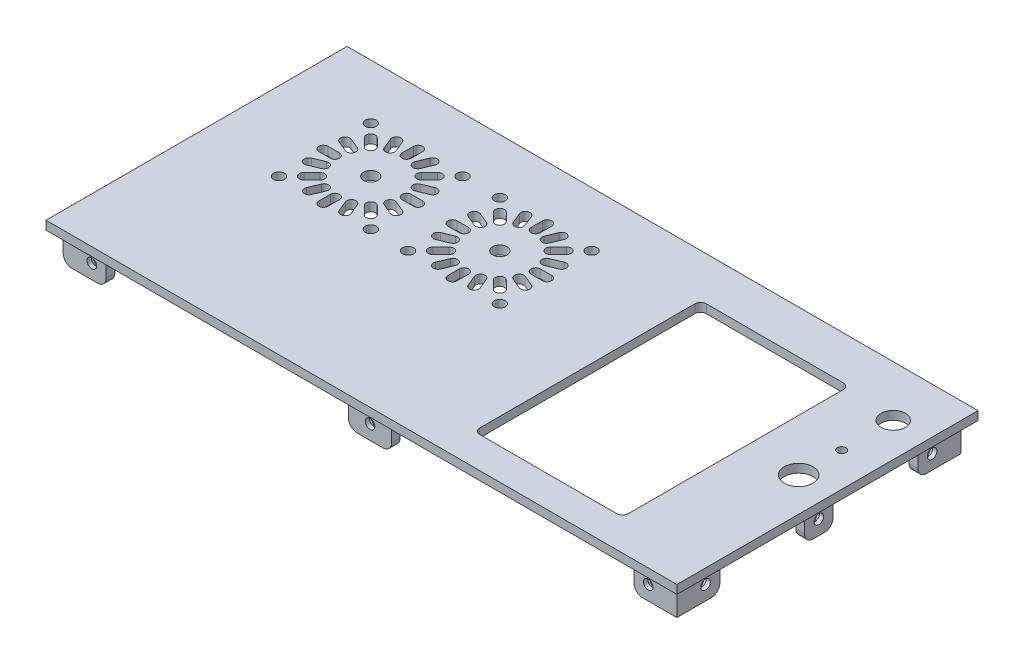
from build123d import *

# Parameters (mm, degrees)
IZIM1_W                     = 220
IZIM1_H                     = 105
IZIM1_R                     = 4.25
IZIM1_R_2                   = 5
IZIM1_R_3                   = 1.5
IZIM1_R_4                   = 1.9
IZIM1_R_5                   = 2.5
Y_KSEKLIK_EKSTR_ZYON1_DEPTH = 3
IZIM2_W                     = 15
IZIM2_H                     = 3
IZIM2_W_2                   = 3
IZIM2_H_2                   = 10
Y_KSEKLIK_EKSTR_ZYON3_DEPTH = 10
IZIM3_R                     = 1.675
KES_EKSTR_ZYON1_DEPTH       = 120
IZIM4_R                     = 1.675
KES_EKSTR_ZYON2_DEPTH       = 215
IZIM5_R                     = 1.675
IZIM5_W                     = 7.5
IZIM5_H                     = 10
KES_EKSTR_ZYON3_DEPTH       = 3
IZIM6_W                     = 12
IZIM6_H                     = 10
KES_EKSTR_ZYON4_DEPTH       = 3
RADYUS1_R                   = 3
KES_EKSTR_ZYON5_DEPTH       = 1.5
KES_EKSTR_ZYON6_DEPTH       = 1.5
KES_EKSTR_ZYON7_DEPTH       = 1.5
KES_EKSTR_ZYON8_DEPTH       = 1.5
PAH1_SIZE                   = 1


with BuildPart() as part:
    # Çizim1 → Yükseklik-Ekstrüzyon1 (new body)
    with BuildSketch(Plane(origin=(0, 0, 0), x_dir=(1, 0, 0), z_dir=(0, 1, 0))):
        Rectangle(IZIM1_W, IZIM1_H)
        with Locations(Location((98.15, 34.8, 0), (0, 0, 270))):
            Circle(IZIM1_R, mode=Mode.SUBTRACT)
        with Locations(Location((98.15, 1.8, 0), (0, 0, 270))):
            Circle(IZIM1_R_2, mode=Mode.SUBTRACT)
        with Locations(Location((98.15, 16.8, 0), (0, 0, 270))):
            Circle(IZIM1_R_3, mode=Mode.SUBTRACT)
        with Locations(Location((-82.65, 33.4, 0), (0, 0, 270))):
            Circle(IZIM1_R_4, mode=Mode.SUBTRACT)
        with Locations(Location((-50.65, 33.4, 0), (0, 0, 270))):
            Circle(IZIM1_R_4, mode=Mode.SUBTRACT)
        with Locations(Location((-37.65, 33.4, 0), (0, 0, 270))):
            Circle(IZIM1_R_4, mode=Mode.SUBTRACT)
        with Locations(Location((-5.65, 33.4, 0), (0, 0, 270))):
            Circle(IZIM1_R_4, mode=Mode.SUBTRACT)
        with Locations(Location((-5.65, 1.4, 0), (0, 0, 270))):
            Circle(IZIM1_R_4, mode=Mode.SUBTRACT)
        with Locations(Location((-37.65, 1.4, 0), (0, 0, 270))):
            Circle(IZIM1_R_4, mode=Mode.SUBTRACT)
        with Locations(Location((-50.65, 1.4, 0), (0, 0, 270))):
            Circle(IZIM1_R_4, mode=Mode.SUBTRACT)
        with Locations(Location((-82.65, 1.4, 0), (0, 0, 270))):
            Circle(IZIM1_R_4, mode=Mode.SUBTRACT)
        with Locations(Location((-66.65, 17.4, 0), (0, 0, 270))):
            Circle(IZIM1_R_5, mode=Mode.SUBTRACT)
        with Locations(Location((-21.65, 17.4, 0), (0, 0, 270))):
            Circle(IZIM1_R_5, mode=Mode.SUBTRACT)
        with BuildLine():
            Line((78.15, 37.4), (30.35, 37.4))
            ThreePointArc((30.35, 37.4), (28.935786438, 36.814213562), (28.35, 35.4))
            Line((28.35, 35.4), (28.35, -39.6))
            ThreePointArc((28.35, -39.6), (28.935786438, -41.014213562), (30.35, -41.6))
            Line((30.35, -41.6), (78.15, -41.6))
            ThreePointArc((78.15, -41.6), (79.564213562, -41.014213562), (80.15, -39.6))
            Line((80.15, -39.6), (80.15, 35.4))
            ThreePointArc((80.15, 35.4), (79.564213562, 36.814213562), (78.15, 37.4))
        make_face(mode=Mode.SUBTRACT)
        with BuildLine():
            Line((-68.25, 29.9), (-68.25, 33.9))
            ThreePointArc((-68.25, 33.9), (-66.65, 35.5), (-65.05, 33.9))
            Line((-65.05, 33.9), (-65.05, 29.9))
            ThreePointArc((-65.05, 29.9), (-66.65, 28.3), (-68.25, 29.9))
        make_face(mode=Mode.SUBTRACT)
        with BuildLine():
            Line((-72.911750157, 28.336200665), (-74.442483886, 32.031718795))
            ThreePointArc((-74.442483886, 32.031718795), (-73.576570126, 34.122219538), (-71.486069382, 33.256305778))
            Line((-71.486069382, 33.256305778), (-69.955335653, 29.560787648))
            ThreePointArc((-69.955335653, 29.560787648), (-70.821249413, 27.470286904), (-72.911750157, 28.336200665))
        make_face(mode=Mode.SUBTRACT)
        with BuildLine():
            Line((-79.15, 19), (-83.15, 19))
            ThreePointArc((-83.15, 19), (-84.75, 17.4), (-83.15, 15.8))
            Line((-83.15, 15.8), (-79.15, 15.8))
            ThreePointArc((-79.15, 15.8), (-77.55, 17.4), (-79.15, 19))
        make_face(mode=Mode.SUBTRACT)
        with BuildLine():
            Line((-77.586200665, 23.661750157), (-81.281718795, 25.192483886))
            ThreePointArc((-81.281718795, 25.192483886), (-83.372219538, 24.326570126), (-82.506305778, 22.236069382))
            Line((-82.506305778, 22.236069382), (-78.810787648, 20.705335653))
            ThreePointArc((-78.810787648, 20.705335653), (-76.720286904, 21.571249413), (-77.586200665, 23.661750157))
        make_face(mode=Mode.SUBTRACT)
        with BuildLine():
            Line((-74.357463915, 27.370205615), (-77.18589104, 30.198632739))
            ThreePointArc((-77.18589104, 30.198632739), (-79.448632739, 30.198632739), (-79.448632739, 27.93589104))
            Line((-79.448632739, 27.93589104), (-76.620205615, 25.107463915))
            ThreePointArc((-76.620205615, 25.107463915), (-74.357463915, 25.107463915), (-74.357463915, 27.370205615))
        make_face(mode=Mode.SUBTRACT)
        with BuildLine():
            Line((-77.586200665, 11.138249843), (-81.281718795, 9.607516114))
            ThreePointArc((-81.281718795, 9.607516114), (-83.372219538, 10.473429874), (-82.506305778, 12.563930618))
            Line((-82.506305778, 12.563930618), (-78.810787648, 14.094664347))
            ThreePointArc((-78.810787648, 14.094664347), (-76.720286904, 13.228750587), (-77.586200665, 11.138249843))
        make_face(mode=Mode.SUBTRACT)
        with BuildLine():
            Line((-74.357463915, 7.429794385), (-77.18589104, 4.601367261))
            ThreePointArc((-77.18589104, 4.601367261), (-79.448632739, 4.601367261), (-79.448632739, 6.86410896))
            Line((-79.448632739, 6.86410896), (-76.620205615, 9.692536085))
            ThreePointArc((-76.620205615, 9.692536085), (-74.357463915, 9.692536085), (-74.357463915, 7.429794385))
        make_face(mode=Mode.SUBTRACT)
        with BuildLine():
            Line((-72.911750157, 6.463799335), (-74.442483886, 2.768281205))
            ThreePointArc((-74.442483886, 2.768281205), (-73.576570126, 0.677780462), (-71.486069382, 1.543694222))
            Line((-71.486069382, 1.543694222), (-69.955335653, 5.239212352))
            ThreePointArc((-69.955335653, 5.239212352), (-70.821249413, 7.329713096), (-72.911750157, 6.463799335))
        make_face(mode=Mode.SUBTRACT)
        with BuildLine():
            Line((-68.25, 4.9), (-68.25, 0.9))
            ThreePointArc((-68.25, 0.9), (-66.65, -0.7), (-65.05, 0.9))
            Line((-65.05, 0.9), (-65.05, 4.9))
            ThreePointArc((-65.05, 4.9), (-66.65, 6.5), (-68.25, 4.9))
        make_face(mode=Mode.SUBTRACT)
        with BuildLine():
            Line((-54.15, 19), (-50.15, 19))
            ThreePointArc((-50.15, 19), (-48.55, 17.4), (-50.15, 15.8))
            Line((-50.15, 15.8), (-54.15, 15.8))
            ThreePointArc((-54.15, 15.8), (-55.75, 17.4), (-54.15, 19))
        make_face(mode=Mode.SUBTRACT)
        with BuildLine():
            Line((-55.713799335, 23.661750157), (-52.018281205, 25.192483886))
            ThreePointArc((-52.018281205, 25.192483886), (-49.927780462, 24.326570126), (-50.793694222, 22.236069382))
            Line((-50.793694222, 22.236069382), (-54.489212352, 20.705335653))
            ThreePointArc((-54.489212352, 20.705335653), (-56.579713096, 21.571249413), (-55.713799335, 23.661750157))
        make_face(mode=Mode.SUBTRACT)
        with BuildLine():
            Line((-58.942536085, 27.370205615), (-56.11410896, 30.198632739))
            ThreePointArc((-56.11410896, 30.198632739), (-53.851367261, 30.198632739), (-53.851367261, 27.93589104))
            Line((-53.851367261, 27.93589104), (-56.679794385, 25.107463915))
            ThreePointArc((-56.679794385, 25.107463915), (-58.942536085, 25.107463915), (-58.942536085, 27.370205615))
        make_face(mode=Mode.SUBTRACT)
        with BuildLine():
            Line((-60.388249843, 28.336200665), (-58.857516114, 32.031718795))
            ThreePointArc((-58.857516114, 32.031718795), (-59.723429874, 34.122219538), (-61.813930618, 33.256305778))
            Line((-61.813930618, 33.256305778), (-63.344664347, 29.560787648))
            ThreePointArc((-63.344664347, 29.560787648), (-62.478750587, 27.470286904), (-60.388249843, 28.336200665))
        make_face(mode=Mode.SUBTRACT)
        with BuildLine():
            Line((-55.713799335, 11.138249843), (-52.018281205, 9.607516114))
            ThreePointArc((-52.018281205, 9.607516114), (-49.927780462, 10.473429874), (-50.793694222, 12.563930618))
            Line((-50.793694222, 12.563930618), (-54.489212352, 14.094664347))
            ThreePointArc((-54.489212352, 14.094664347), (-56.579713096, 13.228750587), (-55.713799335, 11.138249843))
        make_face(mode=Mode.SUBTRACT)
        with BuildLine():
            Line((-58.942536085, 7.429794385), (-56.11410896, 4.601367261))
            ThreePointArc((-56.11410896, 4.601367261), (-53.851367261, 4.601367261), (-53.851367261, 6.86410896))
            Line((-53.851367261, 6.86410896), (-56.679794385, 9.692536085))
            ThreePointArc((-56.679794385, 9.692536085), (-58.942536085, 9.692536085), (-58.942536085, 7.429794385))
        make_face(mode=Mode.SUBTRACT)
        with BuildLine():
            Line((-60.388249843, 6.463799335), (-58.857516114, 2.768281205))
            ThreePointArc((-58.857516114, 2.768281205), (-59.723429874, 0.677780462), (-61.813930618, 1.543694222))
            Line((-61.813930618, 1.543694222), (-63.344664347, 5.239212352))
            ThreePointArc((-63.344664347, 5.239212352), (-62.478750587, 7.329713096), (-60.388249843, 6.463799335))
        make_face(mode=Mode.SUBTRACT)
        with BuildLine():
            Line((-15.388249843, 28.336200665), (-13.857516114, 32.031718795))
            ThreePointArc((-13.857516114, 32.031718795), (-14.723429874, 34.122219538), (-16.813930618, 33.256305778))
            Line((-16.813930618, 33.256305778), (-18.344664347, 29.560787648))
            ThreePointArc((-18.344664347, 29.560787648), (-17.478750587, 27.470286904), (-15.388249843, 28.336200665))
        make_face(mode=Mode.SUBTRACT)
        with BuildLine():
            Line((-13.942536085, 27.370205615), (-11.11410896, 30.198632739))
            ThreePointArc((-11.11410896, 30.198632739), (-8.851367261, 30.198632739), (-8.851367261, 27.93589104))
            Line((-8.851367261, 27.93589104), (-11.679794385, 25.107463915))
            ThreePointArc((-11.679794385, 25.107463915), (-13.942536085, 25.107463915), (-13.942536085, 27.370205615))
        make_face(mode=Mode.SUBTRACT)
        with BuildLine():
            Line((-10.713799335, 23.661750157), (-7.018281205, 25.192483886))
            ThreePointArc((-7.018281205, 25.192483886), (-4.927780462, 24.326570126), (-5.793694222, 22.236069382))
            Line((-5.793694222, 22.236069382), (-9.489212352, 20.705335653))
            ThreePointArc((-9.489212352, 20.705335653), (-11.579713096, 21.571249413), (-10.713799335, 23.661750157))
        make_face(mode=Mode.SUBTRACT)
        with BuildLine():
            Line((-9.15, 19), (-5.15, 19))
            ThreePointArc((-5.15, 19), (-3.55, 17.4), (-5.15, 15.8))
            Line((-5.15, 15.8), (-9.15, 15.8))
            ThreePointArc((-9.15, 15.8), (-10.75, 17.4), (-9.15, 19))
        make_face(mode=Mode.SUBTRACT)
        with BuildLine():
            Line((-10.713799335, 11.138249843), (-7.018281205, 9.607516114))
            ThreePointArc((-7.018281205, 9.607516114), (-4.927780462, 10.473429874), (-5.793694222, 12.563930618))
            Line((-5.793694222, 12.563930618), (-9.489212352, 14.094664347))
            ThreePointArc((-9.489212352, 14.094664347), (-11.579713096, 13.228750587), (-10.713799335, 11.138249843))
        make_face(mode=Mode.SUBTRACT)
        with BuildLine():
            Line((-13.942536085, 7.429794385), (-11.11410896, 4.601367261))
            ThreePointArc((-11.11410896, 4.601367261), (-8.851367261, 4.601367261), (-8.851367261, 6.86410896))
            Line((-8.851367261, 6.86410896), (-11.679794385, 9.692536085))
            ThreePointArc((-11.679794385, 9.692536085), (-13.942536085, 9.692536085), (-13.942536085, 7.429794385))
        make_face(mode=Mode.SUBTRACT)
        with BuildLine():
            Line((-15.388249843, 6.463799335), (-13.857516114, 2.768281205))
            ThreePointArc((-13.857516114, 2.768281205), (-14.723429874, 0.677780462), (-16.813930618, 1.543694222))
            Line((-16.813930618, 1.543694222), (-18.344664347, 5.239212352))
            ThreePointArc((-18.344664347, 5.239212352), (-17.478750587, 7.329713096), (-15.388249843, 6.463799335))
        make_face(mode=Mode.SUBTRACT)
        with BuildLine():
            Line((-20.05, 4.9), (-20.05, 0.9))
            ThreePointArc((-20.05, 0.9), (-21.65, -0.7), (-23.25, 0.9))
            Line((-23.25, 0.9), (-23.25, 4.9))
            ThreePointArc((-23.25, 4.9), (-21.65, 6.5), (-20.05, 4.9))
        make_face(mode=Mode.SUBTRACT)
        with BuildLine():
            Line((-20.05, 29.9), (-20.05, 33.9))
            ThreePointArc((-20.05, 33.9), (-21.65, 35.5), (-23.25, 33.9))
            Line((-23.25, 33.9), (-23.25, 29.9))
            ThreePointArc((-23.25, 29.9), (-21.65, 28.3), (-20.05, 29.9))
        make_face(mode=Mode.SUBTRACT)
        with BuildLine():
            Line((-27.911750157, 6.463799335), (-29.442483886, 2.768281205))
            ThreePointArc((-29.442483886, 2.768281205), (-28.576570126, 0.677780462), (-26.486069382, 1.543694222))
            Line((-26.486069382, 1.543694222), (-24.955335653, 5.239212352))
            ThreePointArc((-24.955335653, 5.239212352), (-25.821249413, 7.329713096), (-27.911750157, 6.463799335))
        make_face(mode=Mode.SUBTRACT)
        with BuildLine():
            Line((-29.357463915, 7.429794385), (-32.18589104, 4.601367261))
            ThreePointArc((-32.18589104, 4.601367261), (-34.448632739, 4.601367261), (-34.448632739, 6.86410896))
            Line((-34.448632739, 6.86410896), (-31.620205615, 9.692536085))
            ThreePointArc((-31.620205615, 9.692536085), (-29.357463915, 9.692536085), (-29.357463915, 7.429794385))
        make_face(mode=Mode.SUBTRACT)
        with BuildLine():
            Line((-32.586200665, 11.138249843), (-36.281718795, 9.607516114))
            ThreePointArc((-36.281718795, 9.607516114), (-38.372219538, 10.473429874), (-37.506305778, 12.563930618))
            Line((-37.506305778, 12.563930618), (-33.810787648, 14.094664347))
            ThreePointArc((-33.810787648, 14.094664347), (-31.720286904, 13.228750587), (-32.586200665, 11.138249843))
        make_face(mode=Mode.SUBTRACT)
        with BuildLine():
            Line((-34.15, 19), (-38.15, 19))
            ThreePointArc((-38.15, 19), (-39.75, 17.4), (-38.15, 15.8))
            Line((-38.15, 15.8), (-34.15, 15.8))
            ThreePointArc((-34.15, 15.8), (-32.55, 17.4), (-34.15, 19))
        make_face(mode=Mode.SUBTRACT)
        with BuildLine():
            Line((-32.586200665, 23.661750157), (-36.281718795, 25.192483886))
            ThreePointArc((-36.281718795, 25.192483886), (-38.372219538, 24.326570126), (-37.506305778, 22.236069382))
            Line((-37.506305778, 22.236069382), (-33.810787648, 20.705335653))
            ThreePointArc((-33.810787648, 20.705335653), (-31.720286904, 21.571249413), (-32.586200665, 23.661750157))
        make_face(mode=Mode.SUBTRACT)
        with BuildLine():
            Line((-29.357463915, 27.370205615), (-32.18589104, 30.198632739))
            ThreePointArc((-32.18589104, 30.198632739), (-34.448632739, 30.198632739), (-34.448632739, 27.93589104))
            Line((-34.448632739, 27.93589104), (-31.620205615, 25.107463915))
            ThreePointArc((-31.620205615, 25.107463915), (-29.357463915, 25.107463915), (-29.357463915, 27.370205615))
        make_face(mode=Mode.SUBTRACT)
        with BuildLine():
            Line((-27.911750157, 28.336200665), (-29.442483886, 32.031718795))
            ThreePointArc((-29.442483886, 32.031718795), (-28.576570126, 34.122219538), (-26.486069382, 33.256305778))
            Line((-26.486069382, 33.256305778), (-24.955335653, 29.560787648))
            ThreePointArc((-24.955335653, 29.560787648), (-25.821249413, 27.470286904), (-27.911750157, 28.336200665))
        make_face(mode=Mode.SUBTRACT)
    extrude(amount=Y_KSEKLIK_EKSTR_ZYON1_DEPTH)

    # Çizim2 → Yükseklik-Ekstrüzyon3 (add)
    with BuildSketch(Plane.XZ):
        Polygon((92, 49.5), (107, 49.5), (107, 34.5), (104, 34.5), (104, 46.5), (92, 46.5), align=None)
        Polygon((107, -34.5), (104, -34.5), (104, -46.5), (92, -46.5), (92, -49.5), (107, -49.5), align=None)
        Polygon((-92, -49.5), (-107, -49.5), (-107, -34.5), (-104, -34.5), (-104, -46.5), (-92, -46.5), align=None)
        Polygon((-92, 46.5), (-92, 49.5), (-107, 49.5), (-107, 34.5), (-104, 34.5), (-104, 46.5), align=None)
        with Locations((0, 48)):
            Rectangle(IZIM2_W, IZIM2_H)
        with Locations((0, -48)):
            Rectangle(IZIM2_W, IZIM2_H)
        with Locations((-105.5, 0)):
            Rectangle(IZIM2_W_2, IZIM2_H_2)
        with Locations((105.5, 0)):
            Rectangle(IZIM2_W_2, IZIM2_H_2)
    extrude(amount=Y_KSEKLIK_EKSTR_ZYON3_DEPTH)

    # Çizim3 → Kes-Ekstrüzyon1 (cut)
    with BuildSketch(Plane.XY.offset(49.5)):
        with Locations((-97, -5)):
            Circle(IZIM3_R)
        with Locations((0, -5)):
            Circle(IZIM3_R)
        with Locations((97, -5)):
            Circle(IZIM3_R)
    extrude(amount=-KES_EKSTR_ZYON1_DEPTH, mode=Mode.SUBTRACT)

    # Çizim4 → Kes-Ekstrüzyon2 (cut)
    with BuildSketch(Plane.ZY.offset(107)):
        with Locations((39.5, -5)):
            Circle(IZIM4_R)
        with Locations((-39.5, -5)):
            Circle(IZIM4_R)
        with Locations((0, -5)):
            Circle(IZIM4_R)
    extrude(amount=-KES_EKSTR_ZYON2_DEPTH, mode=Mode.SUBTRACT)

    # Çizim5 → Kes-Ekstrüzyon3 (cut)
    with BuildSketch(Plane(origin=(0, 0, -49.5), x_dir=(-1, 0, 0), z_dir=(0, 0, -1))):
        with Locations((102, -5)):
            Circle(IZIM5_R)
        with Locations((95.75, -5)):
            Rectangle(IZIM5_W, IZIM5_H)
    extrude(amount=-KES_EKSTR_ZYON3_DEPTH, mode=Mode.SUBTRACT)

    # Çizim6 → Kes-Ekstrüzyon4 (cut)
    with BuildSketch(Plane.ZY.offset(107)):
        with Locations((40.5, -5)):
            Rectangle(IZIM6_W, IZIM6_H)
    extrude(amount=-KES_EKSTR_ZYON4_DEPTH, mode=Mode.SUBTRACT)

    # Radyus1
    radyus1_edges = [part.edges().sort_by_distance(p)[0] for p in [
        (92, -10, -48),
        (105.5, -10, -34.5),
        (105.5, -10, -5),
        (105.5, -10, 5),
        (105.5, -10, 34.5),
        (92, -10, 48),
        (7.5, -10, 48),
        (-7.5, -10, 48),
        (7.5, -10, -48),
        (-7.5, -10, -48),
        (-92, -10, 48),
        (-107, -10, 48),
        (-99.5, -10, -48),
        (-105.5, -10, -5),
        (-105.5, -10, 5),
        (-105.5, -10, -34.5),
    ]]
    fillet(radyus1_edges, radius=RADYUS1_R)

    # Çizim7 → Kes-Ekstrüzyon5 (cut)
    with BuildSketch(Plane.XY.offset(-46.5)):
        Polygon((3.25, -5), (1.625, -2.185417438), (-1.625, -2.185417438), (-3.25, -5), (-1.625, -7.814582562), (1.625, -7.814582562), align=None)
        Polygon((100.25, -5), (98.625, -2.185417438), (95.375, -2.185417438), (93.75, -5), (95.375, -7.814582562), (98.625, -7.814582562), align=None)
        Polygon((-98.75, -5), (-100.375, -2.185417438), (-103.625, -2.185417438), (-105.25, -5), (-103.625, -7.814582562), (-100.375, -7.814582562), align=None)
    extrude(amount=-KES_EKSTR_ZYON5_DEPTH, mode=Mode.SUBTRACT)

    # Çizim8 → Kes-Ekstrüzyon6 (cut)
    with BuildSketch(Plane.ZY.offset(-104)):
        Polygon((3.25, -5), (1.625, -2.185417438), (-1.625, -2.185417438), (-3.25, -5), (-1.625, -7.814582562), (1.625, -7.814582562), align=None)
        Polygon((-36.25, -5), (-37.875, -2.185417438), (-41.125, -2.185417438), (-42.75, -5), (-41.125, -7.814582562), (-37.875, -7.814582562), align=None)
        Polygon((42.75, -5), (41.125, -2.185417438), (37.875, -2.185417438), (36.25, -5), (37.875, -7.814582562), (41.125, -7.814582562), align=None)
    extrude(amount=-KES_EKSTR_ZYON6_DEPTH, mode=Mode.SUBTRACT)

    # Çizim9 → Kes-Ekstrüzyon7 (cut)
    with BuildSketch(Plane(origin=(0, 0, 46.5), x_dir=(-1, 0, 0), z_dir=(0, 0, -1))):
        Polygon((3.25, -5), (1.625, -2.185417438), (-1.625, -2.185417438), (-3.25, -5), (-1.625, -7.814582562), (1.625, -7.814582562), align=None)
        Polygon((100.25, -5), (98.625, -2.185417438), (95.375, -2.185417438), (93.75, -5), (95.375, -7.814582562), (98.625, -7.814582562), align=None)
        Polygon((-93.75, -5), (-95.375, -2.185417438), (-98.625, -2.185417438), (-100.25, -5), (-98.625, -7.814582562), (-95.375, -7.814582562), align=None)
    extrude(amount=-KES_EKSTR_ZYON7_DEPTH, mode=Mode.SUBTRACT)

    # Çizim10 → Kes-Ekstrüzyon8 (cut)
    with BuildSketch(Plane(origin=(-104, 0, 0), x_dir=(0, 0, -1), z_dir=(1, 0, 0))):
        Polygon((42.75, -5), (41.125, -2.185417438), (37.875, -2.185417438), (36.25, -5), (37.875, -7.814582562), (41.125, -7.814582562), align=None)
        Polygon((3.25, -5), (1.625, -2.185417438), (-1.625, -2.185417438), (-3.25, -5), (-1.625, -7.814582562), (1.625, -7.814582562), align=None)
    extrude(amount=-KES_EKSTR_ZYON8_DEPTH, mode=Mode.SUBTRACT)

    # Pah1
    # the kernel refuses this chamfer: 1 mm, written as the material it adds along each edge
    with BuildSketch(Plane(origin=(92, 0, 46.5), x_dir=(-0.9996219169112968, 0.027495876610586483, 0), z_dir=(0, 0, 1)), Plane(origin=(107, 0, 34.5), x_dir=(0, 0.027495876610586292, -0.9996219169112968), z_dir=(-1, 0, 0)), Plane(origin=(92, 0, -46.5), x_dir=(0.027495876610582174, -0.9996219169112968, 0), z_dir=(0, 0, -1)), Plane(origin=(-107, 0, -34.5), x_dir=(0, 0.027495876610586292, 0.9996219169112968), z_dir=(1, 0, 0)), Plane(origin=(7.5, 0, -46.5), x_dir=(0.9996219169112968, 0.027495876610586424, 0), z_dir=(0, 0, -1)), Plane(origin=(-7.5, 0, -49.5), x_dir=(-0.9996219169112968, 0.027495876610586424, 0), z_dir=(0, 0, 1))) as pah1_piece_1:
        Polygon((PAH1_SIZE * 0.999621916911, PAH1_SIZE * 0.0274958766106), (-PAH1_SIZE * 0.0274958766106, PAH1_SIZE * 0.999621916911), (0, 0), align=None)
    extrude(amount=3)
    with BuildSketch(Plane(origin=(106.571682988, 0, 46.5), x_dir=(0, 0.027495876610586292, -0.9996219169112968), z_dir=(-1, 0, 0)), Plane(origin=(104, 0, 34.5), x_dir=(-0.9996219169112968, 0.027495876610586483, 0), z_dir=(0, 0, 1)), Plane(origin=(-104, 0, -34.5), x_dir=(0.9996219169112968, 0.027495876610586483, 0), z_dir=(0, 0, -1))) as pah1_piece_2:
        Polygon((PAH1_SIZE * 0.999621916911, PAH1_SIZE * 0.0274958766106), (-PAH1_SIZE * 0.0274958766106, PAH1_SIZE * 0.999621916911), (0, 0), align=None)
    extrude(amount=14.571682988)
    with BuildSketch(Plane(origin=(107, 0, -34.5), x_dir=(0, 0.027495876610586292, 0.9996219169112968), z_dir=(-1, 0, 0)), Plane(origin=(-92, 0, 46.5), x_dir=(0.9996219169112968, 0.027495876610586483, 0), z_dir=(0, 0, 1)), Plane(origin=(-7.5, 0, 49.5), x_dir=(-0.9996219169112968, 0.027495876610586424, 0), z_dir=(0, 0, -1)), Plane(origin=(7.5, 0, 46.5), x_dir=(0.9996219169112968, 0.027495876610586424, 0), z_dir=(0, 0, 1)), Plane(origin=(-107, 0, -5), x_dir=(0, 0.027495876610586365, -0.9996219169112968), z_dir=(1, 0, 0)), Plane(origin=(-104, 0, 5), x_dir=(0, 0.027495876610586365, 0.9996219169112968), z_dir=(-1, 0, 0)), Plane(origin=(104, 0, -5), x_dir=(0, 0.027495876610586365, -0.9996219169112968), z_dir=(1, 0, 0)), Plane(origin=(107, 0, 5), x_dir=(0, 0.027495876610586365, 0.9996219169112968), z_dir=(-1, 0, 0)), Plane(origin=(-99.5, 0, -49.5), x_dir=(0.9996219169112968, 0.027495876610586483, 0), z_dir=(0, 0, 1))) as pah1_piece_3:
        Polygon((PAH1_SIZE * 0.999621916911, -PAH1_SIZE * 0.0274958766106), (-PAH1_SIZE * 0.0274958766106, -PAH1_SIZE * 0.999621916911), (0, 0), align=None)
    extrude(amount=3)
    with BuildSketch(Plane(origin=(104, 0, -34.5), x_dir=(-0.9996219169112968, 0.027495876610586483, 0), z_dir=(0, 0, -1)), Plane(origin=(106.571682988, 0, -46.5), x_dir=(0, 0.027495876610586292, 0.9996219169112968), z_dir=(-1, 0, 0))) as pah1_piece_4:
        Polygon((PAH1_SIZE * 0.999621916911, -PAH1_SIZE * 0.0274958766106), (-PAH1_SIZE * 0.0274958766106, -PAH1_SIZE * 0.999621916911), (0, 0), align=None)
    extrude(amount=14.571682988)
    with BuildSketch(Plane(origin=(-92, 0, 46.5), x_dir=(0, 0.027495876610586292, -0.9996219169112968), z_dir=(-1, 0, 0)), Plane(origin=(-7.5, 0, -46.5), x_dir=(0, 0.027495876610586292, 0.9996219169112968), z_dir=(1, 0, 0))) as pah1_piece_5:
        Polygon((PAH1_SIZE * 0.999621916911, PAH1_SIZE * 0.0274958766106), (-PAH1_SIZE * 0.0274958766106, PAH1_SIZE * 0.999621916911), (0, 0), align=None)
    extrude(amount=15)
    with BuildSketch(Plane(origin=(-7.5, 0, 46.5), x_dir=(0, 0.027495876610586292, -0.9996219169112968), z_dir=(1, 0, 0))) as pah1_piece_6:
        Polygon((PAH1_SIZE * 0.999621916911, -PAH1_SIZE * 0.0274958766106), (-PAH1_SIZE * 0.0274958766106, -PAH1_SIZE * 0.999621916911), (0, 0), align=None)
    extrude(amount=15)
    with BuildSketch(Plane(origin=(-104, 0, -5), x_dir=(0.9996219169112968, 0.027495876610586483, 0), z_dir=(0, 0, 1))) as pah1_piece_7:
        Polygon((PAH1_SIZE * 0.999621916911, -PAH1_SIZE * 0.0274958766106), (-PAH1_SIZE * 0.0274958766106, -PAH1_SIZE * 0.999621916911), (0, 0), align=None)
    extrude(amount=10)
    with BuildSketch(Plane(origin=(104, 0, 5), x_dir=(-0.9996219169112968, 0.027495876610586483, 0), z_dir=(0, 0, -1))) as pah1_piece_8_section:
        Polygon((PAH1_SIZE * 0.999621916911, -PAH1_SIZE * 0.0274958766106), (-PAH1_SIZE * 0.0274958766106, -PAH1_SIZE * 0.999621916911), (0, 0), align=None)
    pah1_piece_8 = extrude(amount=10, mode=Mode.PRIVATE)
    pah1_piece_8 = pah1_piece_8 - Plane(origin=(98.15, -0.331363921, -1.8), x_dir=(0, 0, 1), z_dir=(0, -1, 0)) * Cylinder(5, 24, mode=Mode.PRIVATE)
    add(pah1_piece_8)
    with BuildSketch(Plane(origin=(-106.571682988, 0, -46.5), x_dir=(0, 0.027495876610586292, 0.9996219169112968), z_dir=(1, 0, 0))) as pah1_piece_9:
        Polygon((PAH1_SIZE * 0.999621916911, PAH1_SIZE * 0.0274958766106), (-PAH1_SIZE * 0.0274958766106, PAH1_SIZE * 0.999621916911), (0, 0), align=None)
    extrude(amount=7.071682988)
    with BuildSketch(Plane(origin=(92, 0, 43.928317012), x_dir=(-0.9996219169112968, 0.027495876610586483, 0), z_dir=(0, 0, 1))) as pah1_piece_10a_section:
        Polygon((PAH1_SIZE * 0.999621916911, PAH1_SIZE * 0.0274958766106), (-PAH1_SIZE * 0.0274958766106, PAH1_SIZE * 0.999621916911), (0, 0), align=None)
    pah1_piece_10a = extrude(amount=5.571682988, mode=Mode.PRIVATE)
    pah1_piece_10a = split(pah1_piece_10a, bisect_by=Plane(origin=(91.670206373, -0.329793627, 46.5), z_dir=(0, 0, -1)), keep=Keep.TOP, mode=Mode.PRIVATE)
    with BuildSketch(Plane(origin=(104, 0, 46.5), x_dir=(0, 0.027495876610586292, -0.9996219169112968), z_dir=(-1, 0, 0))) as pah1_piece_10b_section:
        Polygon((PAH1_SIZE * 0.999621916911, PAH1_SIZE * 0.0274958766106), (-PAH1_SIZE * 0.0274958766106, PAH1_SIZE * 0.999621916911), (0, 0), align=None)
    pah1_piece_10b = extrude(amount=14.571682988, mode=Mode.PRIVATE)
    pah1_piece_10b = split(pah1_piece_10b, bisect_by=Plane(origin=(92, -0.329793627, 46.170206373), z_dir=(-1, 0, 0)), keep=Keep.TOP, mode=Mode.PRIVATE)
    pah1_piece_10 = pah1_piece_10a & pah1_piece_10b
    add(pah1_piece_10)
    with BuildSketch(Plane(origin=(104, 0, 31.928317012), x_dir=(-0.9996219169112968, 0.027495876610586483, 0), z_dir=(0, 0, 1))) as pah1_piece_11a_section:
        Polygon((PAH1_SIZE * 0.999621916911, PAH1_SIZE * 0.0274958766106), (-PAH1_SIZE * 0.0274958766106, PAH1_SIZE * 0.999621916911), (0, 0), align=None)
    pah1_piece_11a = extrude(amount=14.571682988, mode=Mode.PRIVATE)
    pah1_piece_11a = split(pah1_piece_11a, bisect_by=Plane(origin=(103.670206373, -0.329793627, 34.5), z_dir=(0, 0, -1)), keep=Keep.TOP, mode=Mode.PRIVATE)
    with BuildSketch(Plane(origin=(107, 0, 34.5), x_dir=(0, 0.027495876610586292, -0.9996219169112968), z_dir=(-1, 0, 0))) as pah1_piece_11b_section:
        Polygon((PAH1_SIZE * 0.999621916911, PAH1_SIZE * 0.0274958766106), (-PAH1_SIZE * 0.0274958766106, PAH1_SIZE * 0.999621916911), (0, 0), align=None)
    pah1_piece_11b = extrude(amount=5.571682988, mode=Mode.PRIVATE)
    pah1_piece_11b = split(pah1_piece_11b, bisect_by=Plane(origin=(104, -0.329793627, 34.170206373), z_dir=(-1, 0, 0)), keep=Keep.TOP, mode=Mode.PRIVATE)
    pah1_piece_11 = pah1_piece_11a & pah1_piece_11b
    add(pah1_piece_11)
    with BuildSketch(Plane(origin=(107, 0, -34.5), x_dir=(0, 0.027495876610586292, 0.9996219169112968), z_dir=(-1, 0, 0))) as pah1_piece_12a_section:
        Polygon((PAH1_SIZE * 0.999621916911, -PAH1_SIZE * 0.0274958766106), (-PAH1_SIZE * 0.0274958766106, -PAH1_SIZE * 0.999621916911), (0, 0), align=None)
    pah1_piece_12a = extrude(amount=5.571682988, mode=Mode.PRIVATE)
    pah1_piece_12a = pah1_piece_12a - Plane(origin=(98.15, -0.326373221, -34.8), x_dir=(0, 0, 1), z_dir=(0, -1, 0)) * Cylinder(4.25, 16, mode=Mode.PRIVATE)
    pah1_piece_12a = split(pah1_piece_12a, bisect_by=Plane(origin=(104, -0.326373221, -34.163748124), z_dir=(-1, 0, 0)), keep=Keep.TOP, mode=Mode.PRIVATE)
    with BuildSketch(Plane(origin=(104, 0, -31.928317012), x_dir=(-0.9996219169112968, 0.027495876610586483, 0), z_dir=(0, 0, -1))) as pah1_piece_12b_section:
        Polygon((PAH1_SIZE * 0.999621916911, -PAH1_SIZE * 0.0274958766106), (-PAH1_SIZE * 0.0274958766106, -PAH1_SIZE * 0.999621916911), (0, 0), align=None)
    pah1_piece_12b = extrude(amount=14.571682988, mode=Mode.PRIVATE)
    pah1_piece_12b = split(pah1_piece_12b, bisect_by=Plane(origin=(103.670206373, -0.329793627, -34.5), z_dir=(0, 0, 1)), keep=Keep.TOP, mode=Mode.PRIVATE)
    pah1_piece_12 = pah1_piece_12a & pah1_piece_12b
    add(pah1_piece_12)
    with BuildSketch(Plane(origin=(92, 0, -43.928317012), x_dir=(0.027495876610582174, -0.9996219169112968, 0), z_dir=(0, 0, -1))) as pah1_piece_13a_section:
        Polygon((PAH1_SIZE * 0.999621916911, PAH1_SIZE * 0.0274958766106), (-PAH1_SIZE * 0.0274958766106, PAH1_SIZE * 0.999621916911), (0, 0), align=None)
    pah1_piece_13a = extrude(amount=5.571682988, mode=Mode.PRIVATE)
    pah1_piece_13a = split(pah1_piece_13a, bisect_by=Plane(origin=(91.670206373, -0.329793627, -46.5), z_dir=(0, 0, 1)), keep=Keep.TOP, mode=Mode.PRIVATE)
    with BuildSketch(Plane(origin=(104, 0, -46.5), x_dir=(0, 0.027495876610586292, 0.9996219169112968), z_dir=(-1, 0, 0))) as pah1_piece_13b_section:
        Polygon((PAH1_SIZE * 0.999621916911, -PAH1_SIZE * 0.0274958766106), (-PAH1_SIZE * 0.0274958766106, -PAH1_SIZE * 0.999621916911), (0, 0), align=None)
    pah1_piece_13b = extrude(amount=14.571682988, mode=Mode.PRIVATE)
    pah1_piece_13b = split(pah1_piece_13b, bisect_by=Plane(origin=(92, -0.329793627, -46.170206373), z_dir=(-1, 0, 0)), keep=Keep.TOP, mode=Mode.PRIVATE)
    pah1_piece_13 = pah1_piece_13a & pah1_piece_13b
    add(pah1_piece_13)
    with BuildSketch(Plane(origin=(-104, 0, -31.928317012), x_dir=(0.9996219169112968, 0.027495876610586483, 0), z_dir=(0, 0, -1))) as pah1_piece_14a_section:
        Polygon((PAH1_SIZE * 0.999621916911, PAH1_SIZE * 0.0274958766106), (-PAH1_SIZE * 0.0274958766106, PAH1_SIZE * 0.999621916911), (0, 0), align=None)
    pah1_piece_14a = extrude(amount=14.571682988, mode=Mode.PRIVATE)
    pah1_piece_14a = split(pah1_piece_14a, bisect_by=Plane(origin=(-103.670206373, -0.329793627, -34.5), z_dir=(0, 0, 1)), keep=Keep.TOP, mode=Mode.PRIVATE)
    with BuildSketch(Plane(origin=(-107, 0, -34.5), x_dir=(0, 0.027495876610586292, 0.9996219169112968), z_dir=(1, 0, 0))) as pah1_piece_14b_section:
        Polygon((PAH1_SIZE * 0.999621916911, PAH1_SIZE * 0.0274958766106), (-PAH1_SIZE * 0.0274958766106, PAH1_SIZE * 0.999621916911), (0, 0), align=None)
    pah1_piece_14b = extrude(amount=5.571682988, mode=Mode.PRIVATE)
    pah1_piece_14b = split(pah1_piece_14b, bisect_by=Plane(origin=(-104, -0.329793627, -34.170206373), z_dir=(1, 0, 0)), keep=Keep.TOP, mode=Mode.PRIVATE)
    pah1_piece_14 = pah1_piece_14a & pah1_piece_14b
    add(pah1_piece_14)
    with BuildSketch(Plane(origin=(-89.428317012, 0, 46.5), x_dir=(0, 0.027495876610586292, -0.9996219169112968), z_dir=(-1, 0, 0))) as pah1_piece_15a_section:
        Polygon((PAH1_SIZE * 0.999621916911, PAH1_SIZE * 0.0274958766106), (-PAH1_SIZE * 0.0274958766106, PAH1_SIZE * 0.999621916911), (0, 0), align=None)
    pah1_piece_15a = extrude(amount=17.571682988, mode=Mode.PRIVATE)
    pah1_piece_15a = split(pah1_piece_15a, bisect_by=Plane(origin=(-92, -0.329793627, 46.170206373), z_dir=(1, 0, 0)), keep=Keep.TOP, mode=Mode.PRIVATE)
    with BuildSketch(Plane(origin=(-92, 0, 43.928317012), x_dir=(0.9996219169112968, 0.027495876610586483, 0), z_dir=(0, 0, 1))) as pah1_piece_15b_section:
        Polygon((PAH1_SIZE * 0.999621916911, -PAH1_SIZE * 0.0274958766106), (-PAH1_SIZE * 0.0274958766106, -PAH1_SIZE * 0.999621916911), (0, 0), align=None)
    pah1_piece_15b = extrude(amount=5.571682988, mode=Mode.PRIVATE)
    pah1_piece_15b = split(pah1_piece_15b, bisect_by=Plane(origin=(-91.670206373, -0.329793627, 46.5), z_dir=(0, 0, -1)), keep=Keep.TOP, mode=Mode.PRIVATE)
    pah1_piece_15 = pah1_piece_15a & pah1_piece_15b
    add(pah1_piece_15)
    with BuildSketch(Plane(origin=(-7.5, 0, 49.5), x_dir=(-0.9996219169112968, 0.027495876610586424, 0), z_dir=(0, 0, -1))) as pah1_piece_16a_section:
        Polygon((PAH1_SIZE * 0.999621916911, -PAH1_SIZE * 0.0274958766106), (-PAH1_SIZE * 0.0274958766106, -PAH1_SIZE * 0.999621916911), (0, 0), align=None)
    pah1_piece_16a = extrude(amount=5.571682988, mode=Mode.PRIVATE)
    pah1_piece_16a = split(pah1_piece_16a, bisect_by=Plane(origin=(-7.829793627, -0.329793627, 46.5), z_dir=(0, 0, -1)), keep=Keep.TOP, mode=Mode.PRIVATE)
    with BuildSketch(Plane(origin=(-10.071682988, 0, 46.5), x_dir=(0, 0.027495876610586292, -0.9996219169112968), z_dir=(1, 0, 0))) as pah1_piece_16b_section:
        Polygon((PAH1_SIZE * 0.999621916911, -PAH1_SIZE * 0.0274958766106), (-PAH1_SIZE * 0.0274958766106, -PAH1_SIZE * 0.999621916911), (0, 0), align=None)
    pah1_piece_16b = extrude(amount=17.571682988, mode=Mode.PRIVATE)
    pah1_piece_16b = split(pah1_piece_16b, bisect_by=Plane(origin=(-7.5, -0.329793627, 46.170206373), z_dir=(-1, 0, 0)), keep=Keep.TOP, mode=Mode.PRIVATE)
    pah1_piece_16 = pah1_piece_16a & pah1_piece_16b
    add(pah1_piece_16)
    with BuildSketch(Plane(origin=(7.5, 0, 43.928317012), x_dir=(0.9996219169112968, 0.02749587661058639, 0), z_dir=(0, 0, 1))) as pah1_piece_17a_section:
        Polygon((PAH1_SIZE * 0.999621916911, -PAH1_SIZE * 0.0274958766106), (-PAH1_SIZE * 0.0274958766106, -PAH1_SIZE * 0.999621916911), (0, 0), align=None)
    pah1_piece_17a = extrude(amount=5.571682988, mode=Mode.PRIVATE)
    pah1_piece_17a = split(pah1_piece_17a, bisect_by=Plane(origin=(7.829793627, -0.329793627, 46.5), z_dir=(0, 0, -1)), keep=Keep.TOP, mode=Mode.PRIVATE)
    with BuildSketch(Plane(origin=(-7.5, 0, 46.5), x_dir=(0, 0.027495876610586292, -0.9996219169112968), z_dir=(1, 0, 0))) as pah1_piece_17b_section:
        Polygon((PAH1_SIZE * 0.999621916911, -PAH1_SIZE * 0.0274958766106), (-PAH1_SIZE * 0.0274958766106, -PAH1_SIZE * 0.999621916911), (0, 0), align=None)
    pah1_piece_17b = extrude(amount=17.571682988, mode=Mode.PRIVATE)
    pah1_piece_17b = split(pah1_piece_17b, bisect_by=Plane(origin=(7.5, -0.329793627, 46.170206373), z_dir=(1, 0, 0)), keep=Keep.TOP, mode=Mode.PRIVATE)
    pah1_piece_17 = pah1_piece_17a & pah1_piece_17b
    add(pah1_piece_17)
    with BuildSketch(Plane(origin=(7.5, 0, -43.928317012), x_dir=(0.9996219169112968, 0.02749587661058639, 0), z_dir=(0, 0, -1))) as pah1_piece_18a_section:
        Polygon((PAH1_SIZE * 0.999621916911, PAH1_SIZE * 0.0274958766106), (-PAH1_SIZE * 0.0274958766106, PAH1_SIZE * 0.999621916911), (0, 0), align=None)
    pah1_piece_18a = extrude(amount=5.571682988, mode=Mode.PRIVATE)
    pah1_piece_18a = split(pah1_piece_18a, bisect_by=Plane(origin=(7.829793627, -0.329793627, -46.5), z_dir=(0, 0, 1)), keep=Keep.TOP, mode=Mode.PRIVATE)
    with BuildSketch(Plane(origin=(-7.5, 0, -46.5), x_dir=(0, 0.027495876610586292, 0.9996219169112968), z_dir=(1, 0, 0))) as pah1_piece_18b_section:
        Polygon((PAH1_SIZE * 0.999621916911, PAH1_SIZE * 0.0274958766106), (-PAH1_SIZE * 0.0274958766106, PAH1_SIZE * 0.999621916911), (0, 0), align=None)
    pah1_piece_18b = extrude(amount=17.571682988, mode=Mode.PRIVATE)
    pah1_piece_18b = split(pah1_piece_18b, bisect_by=Plane(origin=(7.5, -0.329793627, -46.170206373), z_dir=(1, 0, 0)), keep=Keep.TOP, mode=Mode.PRIVATE)
    pah1_piece_18 = pah1_piece_18a & pah1_piece_18b
    add(pah1_piece_18)
    with BuildSketch(Plane(origin=(-7.5, 0, -49.5), x_dir=(-0.9996219169112968, 0.027495876610586424, 0), z_dir=(0, 0, 1))) as pah1_piece_19a_section:
        Polygon((PAH1_SIZE * 0.999621916911, PAH1_SIZE * 0.0274958766106), (-PAH1_SIZE * 0.0274958766106, PAH1_SIZE * 0.999621916911), (0, 0), align=None)
    pah1_piece_19a = extrude(amount=5.571682988, mode=Mode.PRIVATE)
    pah1_piece_19a = split(pah1_piece_19a, bisect_by=Plane(origin=(-7.829793627, -0.329793627, -46.5), z_dir=(0, 0, 1)), keep=Keep.TOP, mode=Mode.PRIVATE)
    with BuildSketch(Plane(origin=(-10.071682988, 0, -46.5), x_dir=(0, 0.027495876610586292, 0.9996219169112968), z_dir=(1, 0, 0))) as pah1_piece_19b_section:
        Polygon((PAH1_SIZE * 0.999621916911, PAH1_SIZE * 0.0274958766106), (-PAH1_SIZE * 0.0274958766106, PAH1_SIZE * 0.999621916911), (0, 0), align=None)
    pah1_piece_19b = extrude(amount=17.571682988, mode=Mode.PRIVATE)
    pah1_piece_19b = split(pah1_piece_19b, bisect_by=Plane(origin=(-7.5, -0.329793627, -46.170206373), z_dir=(-1, 0, 0)), keep=Keep.TOP, mode=Mode.PRIVATE)
    pah1_piece_19 = pah1_piece_19a & pah1_piece_19b
    add(pah1_piece_19)
    with BuildSketch(Plane(origin=(-104, 0, -7.571682988), x_dir=(0.9996219169112968, 0.027495876610586483, 0), z_dir=(0, 0, 1))) as pah1_piece_20a_section:
        Polygon((PAH1_SIZE * 0.999621916911, -PAH1_SIZE * 0.0274958766106), (-PAH1_SIZE * 0.0274958766106, -PAH1_SIZE * 0.999621916911), (0, 0), align=None)
    pah1_piece_20a = extrude(amount=12.571682988, mode=Mode.PRIVATE)
    pah1_piece_20a = split(pah1_piece_20a, bisect_by=Plane(origin=(-103.670206373, -0.329793627, -5), z_dir=(0, 0, -1)), keep=Keep.TOP, mode=Mode.PRIVATE)
    with BuildSketch(Plane(origin=(-107, 0, -5), x_dir=(0, 0.027495876610586365, -0.9996219169112968), z_dir=(1, 0, 0))) as pah1_piece_20b_section:
        Polygon((PAH1_SIZE * 0.999621916911, -PAH1_SIZE * 0.0274958766106), (-PAH1_SIZE * 0.0274958766106, -PAH1_SIZE * 0.999621916911), (0, 0), align=None)
    pah1_piece_20b = extrude(amount=5.571682988, mode=Mode.PRIVATE)
    pah1_piece_20b = split(pah1_piece_20b, bisect_by=Plane(origin=(-104, -0.329793627, -5.329793627), z_dir=(1, 0, 0)), keep=Keep.TOP, mode=Mode.PRIVATE)
    pah1_piece_20 = pah1_piece_20a & pah1_piece_20b
    add(pah1_piece_20)
    with BuildSketch(Plane(origin=(-104, 0, -5), x_dir=(0.9996219169112968, 0.027495876610586483, 0), z_dir=(0, 0, 1))) as pah1_piece_21a_section:
        Polygon((PAH1_SIZE * 0.999621916911, -PAH1_SIZE * 0.0274958766106), (-PAH1_SIZE * 0.0274958766106, -PAH1_SIZE * 0.999621916911), (0, 0), align=None)
    pah1_piece_21a = extrude(amount=12.571682988, mode=Mode.PRIVATE)
    pah1_piece_21a = split(pah1_piece_21a, bisect_by=Plane(origin=(-103.670206373, -0.329793627, 5), z_dir=(0, 0, 1)), keep=Keep.TOP, mode=Mode.PRIVATE)
    with BuildSketch(Plane(origin=(-101.428317012, 0, 5), x_dir=(0, 0.027495876610586365, 0.9996219169112968), z_dir=(-1, 0, 0))) as pah1_piece_21b_section:
        Polygon((PAH1_SIZE * 0.999621916911, -PAH1_SIZE * 0.0274958766106), (-PAH1_SIZE * 0.0274958766106, -PAH1_SIZE * 0.999621916911), (0, 0), align=None)
    pah1_piece_21b = extrude(amount=5.571682988, mode=Mode.PRIVATE)
    pah1_piece_21b = split(pah1_piece_21b, bisect_by=Plane(origin=(-104, -0.329793627, 5.329793627), z_dir=(1, 0, 0)), keep=Keep.TOP, mode=Mode.PRIVATE)
    pah1_piece_21 = pah1_piece_21a & pah1_piece_21b
    add(pah1_piece_21)
    with BuildSketch(Plane(origin=(107, 0, 5), x_dir=(0, 0.027495876610586365, 0.9996219169112968), z_dir=(-1, 0, 0))) as pah1_piece_22a_section:
        Polygon((PAH1_SIZE * 0.999621916911, -PAH1_SIZE * 0.0274958766106), (-PAH1_SIZE * 0.0274958766106, -PAH1_SIZE * 0.999621916911), (0, 0), align=None)
    pah1_piece_22a = extrude(amount=5.571682988, mode=Mode.PRIVATE)
    pah1_piece_22a = split(pah1_piece_22a, bisect_by=Plane(origin=(104, -0.329793627, 5.329793627), z_dir=(-1, 0, 0)), keep=Keep.TOP, mode=Mode.PRIVATE)
    with BuildSketch(Plane(origin=(104, 0, 7.571682988), x_dir=(-0.9996219169112968, 0.027495876610586483, 0), z_dir=(0, 0, -1))) as pah1_piece_22b_section:
        Polygon((PAH1_SIZE * 0.999621916911, -PAH1_SIZE * 0.0274958766106), (-PAH1_SIZE * 0.0274958766106, -PAH1_SIZE * 0.999621916911), (0, 0), align=None)
    pah1_piece_22b = extrude(amount=12.571682988, mode=Mode.PRIVATE)
    pah1_piece_22b = split(pah1_piece_22b, bisect_by=Plane(origin=(103.670206373, -0.329793627, 5), z_dir=(0, 0, 1)), keep=Keep.TOP, mode=Mode.PRIVATE)
    pah1_piece_22 = pah1_piece_22a & pah1_piece_22b
    add(pah1_piece_22)
    with BuildSketch(Plane(origin=(104, 0, 5), x_dir=(-0.9996219169112968, 0.027495876610586483, 0), z_dir=(0, 0, -1))) as pah1_piece_23a_section:
        Polygon((PAH1_SIZE * 0.999621916911, -PAH1_SIZE * 0.0274958766106), (-PAH1_SIZE * 0.0274958766106, -PAH1_SIZE * 0.999621916911), (0, 0), align=None)
    pah1_piece_23a = extrude(amount=12.571682988, mode=Mode.PRIVATE)
    pah1_piece_23a = split(pah1_piece_23a, bisect_by=Plane(origin=(103.670206373, -0.329793627, -5), z_dir=(0, 0, -1)), keep=Keep.TOP, mode=Mode.PRIVATE)
    with BuildSketch(Plane(origin=(101.428317012, 0, -5), x_dir=(0, 0.027495876610586365, -0.9996219169112968), z_dir=(1, 0, 0))) as pah1_piece_23b_section:
        Polygon((PAH1_SIZE * 0.999621916911, -PAH1_SIZE * 0.0274958766106), (-PAH1_SIZE * 0.0274958766106, -PAH1_SIZE * 0.999621916911), (0, 0), align=None)
    pah1_piece_23b = extrude(amount=5.571682988, mode=Mode.PRIVATE)
    pah1_piece_23b = pah1_piece_23b - Plane(origin=(98.15, -0.318376892, -1.8), x_dir=(0, 0, 1), z_dir=(0, -1, 0)) * Cylinder(5, 16, mode=Mode.PRIVATE)
    pah1_piece_23b = split(pah1_piece_23b, bisect_by=Plane(origin=(104, -0.318376892, -5.35109047), z_dir=(-1, 0, 0)), keep=Keep.TOP, mode=Mode.PRIVATE)
    pah1_piece_23 = pah1_piece_23a & pah1_piece_23b
    add(pah1_piece_23)
    with BuildSketch(Plane(origin=(-99.5, 0, -49.5), x_dir=(0.9996219169112968, 0.027495876610586483, 0), z_dir=(0, 0, 1))) as pah1_piece_24a_section:
        Polygon((PAH1_SIZE * 0.999621916911, -PAH1_SIZE * 0.0274958766106), (-PAH1_SIZE * 0.0274958766106, -PAH1_SIZE * 0.999621916911), (0, 0), align=None)
    pah1_piece_24a = extrude(amount=5.571682988, mode=Mode.PRIVATE)
    pah1_piece_24a = split(pah1_piece_24a, bisect_by=Plane(origin=(-99.170206373, -0.329793627, -46.5), z_dir=(0, 0, 1)), keep=Keep.TOP, mode=Mode.PRIVATE)
    with BuildSketch(Plane(origin=(-104, 0, -46.5), x_dir=(0, 0.027495876610586292, 0.9996219169112968), z_dir=(1, 0, 0))) as pah1_piece_24b_section:
        Polygon((PAH1_SIZE * 0.999621916911, PAH1_SIZE * 0.0274958766106), (-PAH1_SIZE * 0.0274958766106, PAH1_SIZE * 0.999621916911), (0, 0), align=None)
    pah1_piece_24b = extrude(amount=7.071682988, mode=Mode.PRIVATE)
    pah1_piece_24b = split(pah1_piece_24b, bisect_by=Plane(origin=(-99.5, -0.329793627, -46.170206373), z_dir=(1, 0, 0)), keep=Keep.TOP, mode=Mode.PRIVATE)
    pah1_piece_24 = pah1_piece_24a & pah1_piece_24b
    add(pah1_piece_24)


solid = part.part
